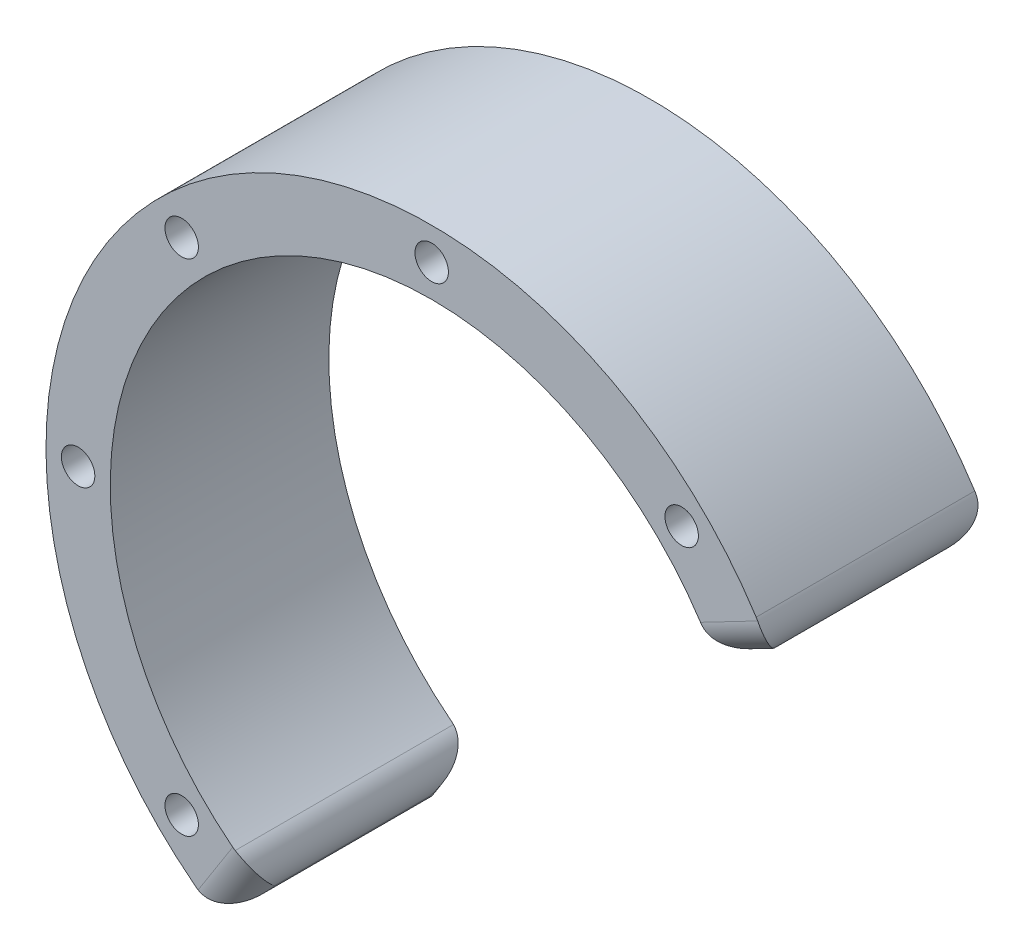
from build123d import *

# Parameters (mm, degrees)
SKETCH_2_R          = 60
SKETCH_2_R_2        = 2.6
SKETCH_2_R_3        = 50
EXTRUDE_1_DEPTH     = 34
CUT_EXTRUDE_START   = -34
SKETCH_3_R          = 2.6
CUT_EXTRUDE_1_DEPTH = 34
FILLET_1_R          = 5


with BuildPart() as part:
    # 草图2 → 凸台-拉伸1 (new body)
    with BuildSketch(Plane.XY):
        Circle(SKETCH_2_R)
        with Locations((0, 55)):
            Circle(SKETCH_2_R_2, mode=Mode.SUBTRACT)
        with Locations((38.890872965, 38.890872965)):
            Circle(SKETCH_2_R_2, mode=Mode.SUBTRACT)
        with Locations((55, 0)):
            Circle(SKETCH_2_R_2, mode=Mode.SUBTRACT)
        with Locations((38.890872965, -38.890872965)):
            Circle(SKETCH_2_R_2, mode=Mode.SUBTRACT)
        with Locations((0, -55)):
            Circle(SKETCH_2_R_2, mode=Mode.SUBTRACT)
        with Locations((-38.890872965, -38.890872965)):
            Circle(SKETCH_2_R_2, mode=Mode.SUBTRACT)
        with Locations((-55, 0)):
            Circle(SKETCH_2_R_2, mode=Mode.SUBTRACT)
        with Locations((-38.890872965, 38.890872965)):
            Circle(SKETCH_2_R_2, mode=Mode.SUBTRACT)
        Circle(SKETCH_2_R_3, mode=Mode.SUBTRACT)
    extrude(amount=EXTRUDE_1_DEPTH)

    # 草图3 → 切除-拉伸1 (cut)
    with BuildSketch(Plane.XY.offset(34).offset(CUT_EXTRUDE_START)):
        with BuildLine():
            Line((53.220649991, 27.704916794), (44.350541659, 23.087430662))
            ThreePointArc((44.350541659, 23.087430662), (48.567103491, 11.884294616), (50, 0))
            ThreePointArc((50, 0), (24.049438446, -43.836337785), (-26.864980417, -42.169572291))
            Line((-26.864980417, -42.169572291), (-32.237976501, -50.603486749))
            ThreePointArc((-32.237976501, -50.603486749), (28.859326135, -52.603605342), (60, 0))
            ThreePointArc((60, 0), (58.280524189, 14.26115354), (53.220649991, 27.704916794))
        make_face()
        with Locations((0, -55)):
            Circle(SKETCH_3_R, mode=Mode.SUBTRACT)
        with Locations((38.890872965, -38.890872965)):
            Circle(SKETCH_3_R, mode=Mode.SUBTRACT)
        with Locations((55, 0)):
            Circle(SKETCH_3_R, mode=Mode.SUBTRACT)
    extrude(amount=CUT_EXTRUDE_1_DEPTH, mode=Mode.SUBTRACT)

    # 圆角1
    fillet_1_edges = [part.edges().sort_by_distance(p)[0] for p in [
        (-26.864980417, -42.169572291, 17),
        (48.785595825, 25.396173728, 34),
        (44.350541659, 23.087430662, 17),
        (53.220649991, 27.704916794, 17),
        (-29.551478459, -46.38652952, 0),
        (-32.237976501, -50.603486749, 17),
        (48.785595825, 25.396173728, 0),
        (-29.551478459, -46.38652952, 34),
    ]]
    fillet(fillet_1_edges, radius=FILLET_1_R - 0.0001)  # a hair under: the kernel refuses the full size


solid = part.part
